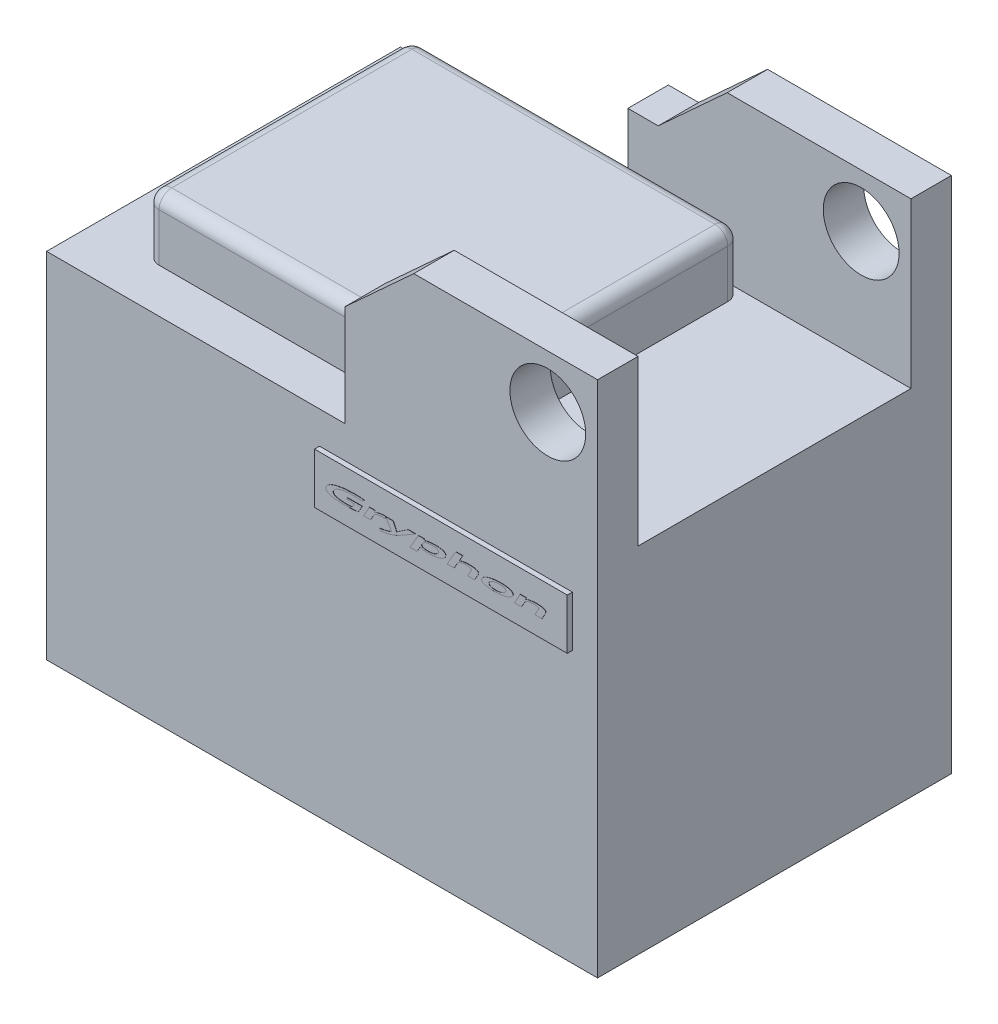
from build123d import *

# Parameters (mm, degrees)
SKETCH2_W           = 218
SKETCH2_H           = 140
BOSS_EXTRUDE1_DEPTH = 140
SKETCH3_W           = 130
SKETCH3_H           = 105
BOSS_EXTRUDE2_DEPTH = 24
FILLET1_R           = 5
FILLET2_R           = 5
BOSS_EXTRUDE3_DEPTH = 16
SKETCH5_R           = 15
CUT_EXTRUDE1_DEPTH  = 16
SKETCH6_W           = 12
SKETCH6_H           = 40
BOSS_EXTRUDE4_DEPTH = 16
SKETCH7_W           = 100
SKETCH7_H           = 20
BOSS_EXTRUDE5_DEPTH = 2
BOSS_EXTRUDE6_DEPTH = 0.1
SKETCH9_R           = 30
CUT_EXTRUDE2_DEPTH  = 1


with BuildPart() as part:
    # Sketch2 → Boss-Extrude1 (new body)
    with BuildSketch(Plane(origin=(0, 0, 0), x_dir=(1, 0, 0), z_dir=(0, 1, 0))):
        Rectangle(SKETCH2_W, SKETCH2_H)
    extrude(amount=BOSS_EXTRUDE1_DEPTH)

    # Sketch3 → Boss-Extrude2 (add)
    with BuildSketch(Plane(origin=(0, 140, 0), x_dir=(1, 0, 0), z_dir=(0, 1, 0))):
        with Locations((-22, 0)):
            Rectangle(SKETCH3_W, SKETCH3_H)
    extrude(amount=BOSS_EXTRUDE2_DEPTH)

    # Fillet1
    fillet1_edges = [part.edges().sort_by_distance(p)[0] for p in [
        (43, 164, 0),
        (-22, 164, -52.5),
        (-87, 164, 0),
        (-22, 164, 52.5),
    ]]
    fillet(fillet1_edges, radius=FILLET1_R)

    # Fillet2
    # the kernel refuses this fillet: 5 mm, written as the material it takes off along each edge
    with BuildSketch(Plane(origin=(38, 159, 47.5), x_dir=(1, 0, 0), z_dir=(0, 0, 1))) as fillet2_piece_1_section:
        Polygon((0, 0), (FILLET2_R, 0), (FILLET2_R, FILLET2_R), (0, FILLET2_R), align=None)
    fillet2_piece_1 = extrude(amount=FILLET2_R, mode=Mode.PRIVATE)
    fillet2_piece_1 = fillet2_piece_1 - Plane(origin=(38, 159, 47.5), x_dir=(-0.7071067811865475, -0.7071067811865475, 0), z_dir=(0, 0, 1)) * Sphere(FILLET2_R, mode=Mode.PRIVATE)
    add(fillet2_piece_1, mode=Mode.SUBTRACT)
    with BuildSketch(Plane(origin=(-82, 159, 47.5), x_dir=(-1, 0, 0), z_dir=(0, 0, 1))) as fillet2_piece_2_section:
        Polygon((0, 0), (FILLET2_R, 0), (FILLET2_R, -FILLET2_R), (0, -FILLET2_R), align=None)
    fillet2_piece_2 = extrude(amount=FILLET2_R, mode=Mode.PRIVATE)
    fillet2_piece_2 = fillet2_piece_2 - Plane(origin=(-82, 159, 47.5), x_dir=(0.7071067811865475, -0.7071067811865475, 0), z_dir=(0, 0, 1)) * Sphere(FILLET2_R, mode=Mode.PRIVATE)
    add(fillet2_piece_2, mode=Mode.SUBTRACT)
    with BuildSketch(Plane(origin=(38, 159, -47.5), x_dir=(0, 0, -1), z_dir=(1, 0, 0))) as fillet2_piece_3_section:
        Polygon((0, 0), (FILLET2_R, 0), (FILLET2_R, FILLET2_R), (0, FILLET2_R), align=None)
    fillet2_piece_3 = extrude(amount=FILLET2_R, mode=Mode.PRIVATE)
    fillet2_piece_3 = fillet2_piece_3 - Plane(origin=(38, 159, -47.5), x_dir=(0, -0.7071067811865475, 0.7071067811865475), z_dir=(1, 0, 0)) * Sphere(FILLET2_R, mode=Mode.PRIVATE)
    add(fillet2_piece_3, mode=Mode.SUBTRACT)
    with BuildSketch(Plane(origin=(-82, 159, -47.5), x_dir=(0, 0, -1), z_dir=(-1, 0, 0))) as fillet2_piece_4_section:
        Polygon((0, 0), (FILLET2_R, 0), (FILLET2_R, -FILLET2_R), (0, -FILLET2_R), align=None)
    fillet2_piece_4 = extrude(amount=FILLET2_R, mode=Mode.PRIVATE)
    fillet2_piece_4 = fillet2_piece_4 - Plane(origin=(-82, 159, -47.5), x_dir=(0, -0.7071067811865475, 0.7071067811865475), z_dir=(-1, 0, 0)) * Sphere(FILLET2_R, mode=Mode.PRIVATE)
    add(fillet2_piece_4, mode=Mode.SUBTRACT)
    with BuildSketch(Plane(origin=(-87, 140, -52.5), x_dir=(0, 0, 1), z_dir=(0, 1, 0)), Plane(origin=(-87, 140, 52.5), x_dir=(1, 0, 0), z_dir=(0, 1, 0))) as fillet2_piece_5:
        with BuildLine():
            CenterArc((FILLET2_R, FILLET2_R), FILLET2_R, 180, 90)
            Line((0, FILLET2_R), (0, 0))
            Line((0, 0), (FILLET2_R, 0))
        make_face()
    extrude(amount=19, mode=Mode.SUBTRACT)
    with BuildSketch(Plane(origin=(43, 140, -52.5), x_dir=(0, 0, 1), z_dir=(0, 1, 0)), Plane(origin=(43, 140, 52.5), x_dir=(-1, 0, 0), z_dir=(0, 1, 0))) as fillet2_piece_6:
        with BuildLine():
            CenterArc((FILLET2_R, -FILLET2_R), FILLET2_R, 90, 90)
            Line((0, -FILLET2_R), (0, 0))
            Line((0, 0), (FILLET2_R, 0))
        make_face()
    extrude(amount=19, mode=Mode.SUBTRACT)

    # Sketch4 → Boss-Extrude3 (add)
    with BuildSketch(Plane.XY.offset(70)):
        Polygon((109, 140), (109, 205), (36.276363394, 205), (9, 180), (9, 140), align=None)
    boss_extrude3 = extrude(amount=-BOSS_EXTRUDE3_DEPTH)

    # Sketch5 → Cut-Extrude1 (cut)
    with BuildSketch(Plane.XY.offset(70)):
        with Locations((89.3, 184)):
            Circle(SKETCH5_R)
    cut_extrude1 = extrude(amount=-CUT_EXTRUDE1_DEPTH, mode=Mode.SUBTRACT)

    # Mirror1: Boss-Extrude3, Cut-Extrude1 across plane
    add(boss_extrude3.mirror(Plane.XY))
    add(cut_extrude1.mirror(Plane.XY), mode=Mode.SUBTRACT)

    # Sketch6 → Boss-Extrude4 (add)
    with BuildSketch(Plane(origin=(0, 0, -70), x_dir=(-1, 0, 0), z_dir=(0, 0, -1))):
        with Locations((-3, 160)):
            Rectangle(SKETCH6_W, SKETCH6_H)
    extrude(amount=-BOSS_EXTRUDE4_DEPTH)

    # Sketch7 → Boss-Extrude5 (add)
    with BuildSketch(Plane.XY.offset(70)):
        with Locations((49, 117.237797082)):
            Rectangle(SKETCH7_W, SKETCH7_H)
    extrude(amount=BOSS_EXTRUDE5_DEPTH)

    # Sketch8 → Boss-Extrude6 (add)
    # profile 1 of 7: a face of its own
    with BuildSketch(Plane.XY.offset(72)):
        with BuildLine():
            Line((17.96418734, 117.160679351), (12.141424909, 117.160679351))
            Line((12.141424909, 117.160679351), (11.764252894, 116.507481764))
            Line((11.764252894, 116.507481764), (14.911006135, 116.507481764))
            Line((14.911006135, 116.507481764), (13.993461477, 114.918447558))
            add(Edge.make_bspline(
                [(13.993461477, 114.918447558), (13.963867753, 114.913749876), (13.901788444, 114.90389546), (13.803476553, 114.893148704), (13.696442108, 114.881185383), (13.579823698, 114.870688454), (13.454037911, 114.861613482), (13.318837078, 114.852066784), (13.174532896, 114.842381459), (13.02105319, 114.834005069), (12.85876924, 114.827083667), (12.688146369, 114.819002949), (12.509005078, 114.814200097), (12.321812502, 114.810219119), (12.126216566, 114.805748161), (11.922530752, 114.802301562), (11.710404062, 114.801912003), (11.566420365, 114.801136188), (11.493023831, 114.800740711)],
                knots=[0, 0, 0, 0, 0.57408566, 1.204270245, 1.894635667, 2.637907874, 3.447688264, 4.311161431, 5.235058642, 6.219005921, 7.256383574, 8.347542599, 9.492013257, 10.690125786, 11.935331768, 13.240966305, 14.593566391, 16, 16, 16, 16], degree=3))
            add(Edge.make_bspline(
                [(11.493023831, 114.800740711), (11.381341874, 114.800997446), (11.161464178, 114.8015029), (10.837329716, 114.809889757), (10.523626716, 114.819339559), (10.220954787, 114.836054151), (9.928954903, 114.853872535), (9.648110226, 114.879138813), (9.377820988, 114.90543574), (9.118301494, 114.938454561), (8.870042989, 114.97544854), (8.63200088, 115.014929711), (8.405129322, 115.06033697), (8.188945239, 115.109439006), (7.984061041, 115.163917326), (7.789164602, 115.219602357), (7.605623199, 115.282334188), (7.4331045, 115.348025603), (7.273658095, 115.418042822), (7.127908112, 115.491816259), (6.99753411, 115.570294951), (6.882044694, 115.653185078), (6.779479276, 115.73772556), (6.694107429, 115.829049614), (6.622283725, 115.923228455), (6.56579689, 116.022008545), (6.524379303, 116.124833635), (6.497606929, 116.231855596), (6.485809538, 116.342892836), (6.49106782, 116.45753431), (6.508789855, 116.576139764), (6.543707219, 116.697835018), (6.590779079, 116.824610486), (6.633176026, 116.907180828), (6.655147511, 116.949971481)],
                knots=[0, 0, 0, 0, 1.727237085, 3.400557444, 5.014613926, 6.580993404, 8.088679817, 9.538837814, 10.941847069, 12.288552396, 13.584395749, 14.823779686, 16.01999539, 17.162332673, 18.251837206, 19.298587379, 20.296512985, 21.250734898, 22.15296166, 22.988576607, 23.775688061, 24.503685507, 25.185911807, 25.827582618, 26.432647762, 27.014041907, 27.581882356, 28.141743999, 28.715167865, 29.302167277, 29.91208856, 30.565671226, 31.2566839, 32, 32, 32, 32], degree=3))
            add(Edge.make_bspline(
                [(6.655147511, 116.949971481), (6.684655585, 116.995068392), (6.744030174, 117.085810018), (6.846838111, 117.214257209), (6.957828629, 117.340316307), (7.082343454, 117.460002751), (7.21599827, 117.577555081), (7.361739032, 117.689874858), (7.517895289, 117.798438206), (7.684806298, 117.903024073), (7.862960005, 118.002711277), (8.051954066, 118.09886548), (8.252141716, 118.190123435), (8.463273682, 118.27775652), (8.685459183, 118.360749705), (8.9186607, 118.439291373), (9.162030764, 118.515950444), (9.505225075, 118.609573924), (9.952292679, 118.719157948), (10.509665455, 118.829688823), (11.091206278, 118.924549597), (11.696627935, 119.00227334), (12.326685091, 119.061881869), (12.980861572, 119.10448516), (13.659580997, 119.131732757), (14.120186117, 119.134611946), (14.354450678, 119.136076307)],
                knots=[0, 0, 0, 0, 0.469271586, 0.944243537, 1.431828891, 1.931625201, 2.447685653, 2.981954091, 3.533635011, 4.104102054, 4.697262929, 5.3116336, 5.950994489, 6.613508287, 7.302840866, 8.016880278, 8.757174479, 9.525441728, 11.115690773, 12.766372667, 14.474532637, 16.248290545, 18.08315634, 19.987281648, 21.959124501, 24, 24, 24, 24], degree=3))
            add(Edge.make_bspline(
                [(14.354450678, 119.136076307), (14.455591862, 119.135883232), (14.654016317, 119.135504447), (14.945154136, 119.132269895), (15.224006455, 119.127171572), (15.490189138, 119.119452801), (15.744128013, 119.111466664), (15.985751331, 119.100834286), (16.214755339, 119.08846957), (16.431752134, 119.073366425), (16.638249228, 119.057522245), (16.83598195, 119.040771545), (17.025970134, 119.02277738), (17.207922773, 119.004081581), (17.381663011, 118.983565642), (17.547281303, 118.964428243), (17.704435932, 118.941602696), (17.806569248, 118.926445942), (17.856432579, 118.919046141)],
                knots=[0, 0, 0, 0, 1.382312646, 2.711898585, 3.979238108, 5.194018751, 6.351375805, 7.451547184, 8.499458767, 9.485682463, 10.42438263, 11.32998213, 12.197766839, 13.032591748, 13.829770182, 14.588816052, 15.311034485, 16, 16, 16, 16], degree=3))
            Line((17.856432579, 118.919046141), (18.88391728, 119.622447592))
            add(Edge.make_bspline(
                [(18.88391728, 119.622447592), (18.82907582, 119.631239698), (18.714746639, 119.649568792), (18.536120008, 119.673186776), (18.34436921, 119.696423533), (18.139257235, 119.718487602), (17.92050383, 119.739766617), (17.687934747, 119.758235426), (17.44210672, 119.776205402), (17.183654582, 119.793159181), (16.913926029, 119.807811279), (16.634344306, 119.819993244), (16.346069481, 119.832365892), (16.048208939, 119.839923941), (15.741643863, 119.847759234), (15.425919182, 119.852849201), (15.101420828, 119.856124084), (14.881926133, 119.856506689), (14.770600754, 119.856700741)],
                knots=[0, 0, 0, 0, 0.646480929, 1.347732822, 2.097122365, 2.894782075, 3.748959429, 4.655347781, 5.610329598, 6.618045377, 7.67015949, 8.754528216, 9.875479017, 11.028693505, 12.222664842, 13.445078509, 14.704170934, 16, 16, 16, 16], degree=3))
            add(Edge.make_bspline(
                [(14.770600754, 119.856700741), (14.598515517, 119.855782061), (14.257123811, 119.853959534), (13.749649851, 119.842717363), (13.251251812, 119.827604556), (12.762067338, 119.804801653), (12.282187085, 119.778616354), (11.811742001, 119.742412352), (11.350380907, 119.704899163), (10.898150512, 119.657668441), (10.455254661, 119.606266982), (10.021279908, 119.55008729), (9.59732292, 119.48471575), (9.181438535, 119.417441864), (8.775630933, 119.340977057), (8.378588873, 119.260191357), (7.991269873, 119.172579567), (7.613952321, 119.080217035), (7.249195113, 118.983520628), (6.900959133, 118.878240321), (6.567919825, 118.771833105), (6.252424356, 118.657638634), (5.952407784, 118.540010744), (5.669299791, 118.416747891), (5.402126848, 118.289699693), (5.151942403, 118.15665608), (4.918194529, 118.019343833), (4.701193413, 117.876174476), (4.499661392, 117.729832134), (4.316173794, 117.576112981), (4.147613093, 117.419578265), (3.996749197, 117.256500839), (3.860712029, 117.089707851), (3.782628811, 116.972050253), (3.744204072, 116.914150968)],
                knots=[0, 0, 0, 0, 1.406086872, 2.789468771, 4.147410128, 5.480206865, 6.790810134, 8.074091919, 9.335395925, 10.572856075, 11.789057602, 12.978545271, 14.148113698, 15.293966537, 16.420685553, 17.521997493, 18.604487486, 19.665124284, 20.695970946, 21.687338376, 22.637427463, 23.552351842, 24.428362842, 25.27010105, 26.074832485, 26.845032507, 27.584693568, 28.289029961, 28.96856128, 29.618488189, 30.243756049, 30.846788552, 31.432504833, 32, 32, 32, 32], degree=3))
            add(Edge.make_bspline(
                [(3.744204072, 116.914150968), (3.719238936, 116.875069421), (3.669863861, 116.797775458), (3.61507779, 116.67165795), (3.576640721, 116.540410191), (3.556597187, 116.403180591), (3.555195325, 116.260949298), (3.569850703, 116.113467292), (3.604190358, 115.961065474), (3.64343369, 115.830603336), (3.688091303, 115.725069148), (3.734620857, 115.646226799), (3.791361265, 115.568535933), (3.859638986, 115.49255629), (3.937983451, 115.417322099), (4.027922565, 115.344042282), (4.128349435, 115.27096871), (4.24004191, 115.200131716), (4.361709703, 115.128965679), (4.494735883, 115.059652801), (4.638971446, 114.991468878), (4.794006695, 114.924242261), (4.959527133, 114.857366524), (5.136857387, 114.794089841), (5.324000422, 114.729271721), (5.523464589, 114.666793943), (5.736913477, 114.606481137), (5.967285044, 114.54934804), (6.215140066, 114.497363859), (6.480776251, 114.448869558), (6.763276094, 114.404147871), (7.06347213, 114.361445146), (7.381138779, 114.324366413), (7.716472142, 114.289106175), (8.069192458, 114.259278387), (8.439308133, 114.23140588), (8.826754147, 114.208909174), (9.23165021, 114.188422581), (9.654182227, 114.173226529), (10.094209983, 114.160223934), (10.55183384, 114.152106338), (10.862650661, 114.149083496), (11.021035897, 114.147543125)],
                knots=[0, 0, 0, 0, 0.621266322, 1.228716371, 1.836969588, 2.451213088, 3.082524631, 3.740632516, 4.434522164, 5.175010374, 5.565321413, 5.96849714, 6.40003937, 6.853839433, 7.336938835, 7.855656977, 8.408764672, 9.002020693, 9.628993758, 10.299048017, 11.013376269, 11.768641283, 12.565552984, 13.407514051, 14.293899999, 15.222110112, 16.21084147, 17.26882304, 18.405238495, 19.607330629, 20.890611674, 22.241670805, 23.674391156, 25.180455862, 26.764460969, 28.422466226, 30.15911932, 31.970262377, 33.860596466, 35.830503518, 37.875318711, 40, 40, 40, 40], degree=3))
            add(Edge.make_bspline(
                [(11.021035897, 114.147543125), (11.292158928, 114.149189648), (11.824980058, 114.152425458), (12.609928217, 114.171052646), (13.366115067, 114.197822408), (13.976373838, 114.229204442), (14.444433587, 114.257263297), (14.773754485, 114.28004684), (15.085341732, 114.300530321), (15.378613796, 114.322380222), (15.654164386, 114.346412483), (15.911731351, 114.367567397), (16.151188035, 114.391061345), (16.304571409, 114.407324838), (16.378309653, 114.415143426)],
                knots=[0, 0, 0, 0, 1.818900664, 3.574571683, 5.267282731, 6.895007302, 7.673911258, 8.412994653, 9.109607772, 9.76878893, 10.385883484, 10.965218059, 11.502534069, 12, 12, 12, 12], degree=3))
            Line((16.378309653, 114.415143426), (17.96418734, 117.160679351))
        make_face()
    # profile 2 of 7: a face of its own
    with BuildSketch(Plane.XY.offset(72)):
        with BuildLine():
            add(Edge.make_bspline(
                [(27.491893726, 118.313258057), (27.433896933, 118.311980744), (27.320776615, 118.309489398), (27.151423376, 118.309582928), (26.978662823, 118.312937684), (26.861009024, 118.312456085), (26.799550377, 118.312204512)],
                knots=[0, 0, 0, 0, 1.005383454, 1.96095836, 2.934868736, 4, 4, 4, 4], degree=3))
            add(Edge.make_bspline(
                [(26.799550377, 118.312204512), (26.617566055, 118.309134304), (26.255250109, 118.30302177), (25.715402859, 118.261101579), (25.182197914, 118.192052111), (24.744298082, 118.114555374), (24.402576573, 118.040249516), (24.157471181, 117.979501817), (23.924105013, 117.911708592), (23.70137733, 117.840606378), (23.490231322, 117.763421739), (23.289590012, 117.681535403), (23.100166708, 117.593421838), (22.97948502, 117.529238587), (22.920399547, 117.497814618)],
                knots=[0, 0, 0, 0, 1.637789355, 3.260705074, 4.869975785, 6.475116374, 7.261198031, 8.017024643, 8.74725353, 9.44791687, 10.120828127, 10.769975949, 11.397783091, 12, 12, 12, 12], degree=3))
            Line((22.920399547, 117.497814618), (22.825409753, 117.497945282))
            Line((22.825409753, 117.497945282), (23.162218874, 118.245831209))
            Line((23.162218874, 118.245831209), (20.762169409, 118.245831209))
            add(Edge.make_bspline(
                [(20.762169409, 118.245831209), (20.723568027, 118.151673513), (20.64306938, 117.955318705), (20.499301233, 117.65690486), (20.333753687, 117.339783415), (20.21042803, 117.125473461), (20.146416893, 117.014237695)],
                knots=[0, 0, 0, 0, 0.8858633, 1.847363787, 2.882692406, 4, 4, 4, 4], degree=3))
            Line((20.146416893, 117.014237695), (18.526394692, 114.208647676))
            Line((18.526394692, 114.208647676), (21.282474293, 114.208647676))
            Line((21.282474293, 114.208647676), (22.517860156, 116.348130073))
            add(Edge.make_bspline(
                [(22.517860156, 116.348130073), (22.546566471, 116.391955573), (22.605557802, 116.48201675), (22.719418005, 116.603449406), (22.852571251, 116.718917634), (23.005805599, 116.828593122), (23.180410698, 116.930272136), (23.375400848, 117.025031342), (23.590644763, 117.112942134), (23.825089025, 117.194852149), (24.076513342, 117.268064002), (24.342949878, 117.33067293), (24.622259038, 117.385610574), (24.915345884, 117.430908708), (25.222241307, 117.465271956), (25.542384331, 117.489842806), (25.875746476, 117.507752412), (26.102430496, 117.510241673), (26.217993816, 117.511510696)],
                knots=[0, 0, 0, 0, 0.625962778, 1.286350288, 1.983352948, 2.733271445, 3.537654452, 4.398485167, 5.325657178, 6.318518059, 7.369174495, 8.457841149, 9.592775774, 10.774999121, 12.005801768, 13.287375244, 14.617106219, 16, 16, 16, 16], degree=3))
            add(Edge.make_bspline(
                [(26.217993816, 117.511510696), (26.29209651, 117.511437435), (26.435398615, 117.51129576), (26.642597552, 117.506581354), (26.834763535, 117.50103783), (26.957594432, 117.493878078), (27.016580543, 117.490439806)],
                knots=[0, 0, 0, 0, 1.112907013, 2.152174352, 3.112633302, 4, 4, 4, 4], degree=3))
            Line((27.016580543, 117.490439806), (27.491893726, 118.313258057))
        make_face()
    # profile 3 of 7: a face of its own
    with BuildSketch(Plane.XY.offset(72)):
        with BuildLine():
            Line((36.170676799, 118.245831209), (32.744792911, 115.988344628))
            add(Edge.make_bspline(
                [(32.744792911, 115.988344628), (32.644622311, 115.919301242), (32.443796919, 115.780880738), (32.19225233, 115.610285692), (31.996649232, 115.471998789), (31.854368057, 115.374544562), (31.720673674, 115.278574594), (31.633169453, 115.216500902), (31.590649321, 115.186337996)],
                knots=[0, 0, 0, 0, 1.55811736, 3.123766129, 3.892371864, 4.625979904, 5.332334883, 6, 6, 6, 6], degree=3))
            Line((31.590649321, 115.186337996), (31.51915645, 115.187301002))
            add(Edge.make_bspline(
                [(31.51915645, 115.187301002), (31.503228451, 115.249564489), (31.469916814, 115.379781644), (31.412878336, 115.579400268), (31.346538913, 115.78499973), (31.2928783, 115.920574791), (31.266157617, 115.988085357)],
                knots=[0, 0, 0, 0, 0.917495057, 1.918838817, 2.963670987, 4, 4, 4, 4], degree=3))
            Line((31.266157617, 115.988085357), (30.185146888, 118.245831209))
            Line((30.185146888, 118.245831209), (27.156611833, 118.245831209))
            Line((27.156611833, 118.245831209), (29.527545814, 114.546466101))
            add(Edge.make_bspline(
                [(29.527545814, 114.546466101), (29.540604462, 114.528749209), (29.563864002, 114.497192591), (29.586387559, 114.44949018), (29.590053969, 114.404132969), (29.575805691, 114.381747916), (29.568897436, 114.370894557)],
                knots=[0, 0, 0, 0, 1.350795105, 2.405982161, 3.227142866, 4, 4, 4, 4], degree=3))
            add(Edge.make_bspline(
                [(29.568897436, 114.370894557), (29.565976553, 114.365445129), (29.558805163, 114.352065618), (29.538720218, 114.334448029), (29.512245756, 114.312622623), (29.476207123, 114.290508617), (29.432707119, 114.264516529), (29.379727072, 114.237898271), (29.31896669, 114.207002187), (29.24878228, 114.174578521), (29.170786858, 114.138726007), (29.083555492, 114.102257846), (28.988770319, 114.06165214), (28.884653469, 114.01988492), (28.771703552, 113.975847051), (28.650781795, 113.928179159), (28.521137616, 113.878798301), (28.383250966, 113.827181144), (28.237059771, 113.773733146), (28.080791952, 113.723620094), (27.9154681, 113.674590932), (27.74195634, 113.624516881), (27.559120904, 113.577422217), (27.367660519, 113.531268109), (27.167610149, 113.485621015), (26.958363686, 113.443026217), (26.740402541, 113.399528859), (26.513253972, 113.357219012), (26.276988964, 113.318003958), (26.032463693, 113.277066614), (25.778735168, 113.239812907), (25.516073811, 113.202736703), (25.244589592, 113.166985131), (25.060447207, 113.144426045), (24.967015083, 113.132979776)],
                knots=[0, 0, 0, 0, 0.1227252, 0.301316599, 0.52592964, 0.810045162, 1.143347849, 1.538726561, 1.993668565, 2.505240093, 3.082963426, 3.708466264, 4.393857033, 5.14296516, 5.949408303, 6.815787384, 7.739575849, 8.720825834, 9.757185161, 10.848757423, 11.998524505, 13.202167461, 14.45627752, 15.769925468, 17.136625498, 18.555209431, 20.035678654, 21.576842086, 23.170819032, 24.820157964, 26.529709358, 28.293799972, 30.119508779, 32, 32, 32, 32], degree=3))
            Line((24.967015083, 113.132979776), (25.271174613, 112.420059386))
            add(Edge.make_bspline(
                [(25.271174613, 112.420059386), (25.315890986, 112.422588203), (25.409847145, 112.427901647), (25.556391249, 112.439738256), (25.71512871, 112.454573019), (25.885054058, 112.472651518), (26.06659363, 112.492853793), (26.259904052, 112.514392884), (26.464472669, 112.541452777), (26.757052072, 112.579296491), (27.139851989, 112.635473807), (27.615582292, 112.720988771), (28.112429868, 112.820392803), (28.449507053, 112.897577444), (28.621760935, 112.9370205)],
                knots=[0, 0, 0, 0, 0.475047191, 0.998149148, 1.559321855, 2.166079221, 2.810669925, 3.496811616, 4.229124421, 4.999336376, 6.626083314, 8.332266493, 10.125707211, 12, 12, 12, 12], degree=3))
            add(Edge.make_bspline(
                [(28.621760935, 112.9370205), (28.733963619, 112.965875606), (28.959187284, 113.02379626), (29.294280853, 113.122487627), (29.629148743, 113.227827129), (29.962627229, 113.341326778), (30.295151496, 113.463951534), (30.626539429, 113.594756412), (30.957978077, 113.732232515), (31.289235468, 113.881326438), (31.626451413, 114.039661523), (31.973725011, 114.20769231), (32.332490046, 114.38889873), (32.703781303, 114.579834914), (33.086883992, 114.78367046), (33.481117373, 114.999884284), (33.888501472, 115.225866659), (34.162209508, 115.383332158), (34.301419306, 115.463420198)],
                knots=[0, 0, 0, 0, 0.891541351, 1.789584743, 2.687949359, 3.593053526, 4.500285741, 5.415214587, 6.334746377, 7.261447158, 8.210561812, 9.201745757, 10.230327648, 11.303709871, 12.414826369, 13.569882142, 14.764025269, 16, 16, 16, 16], degree=3))
            Line((34.301419306, 115.463420198), (39.07997819, 118.245831209))
            Line((39.07997819, 118.245831209), (36.170676799, 118.245831209))
        make_face()
    # profile 4 of 7: a face of its own
    with BuildSketch(Plane.XY.offset(72)):
        with BuildLine():
            Line((42.311969148, 117.631749548), (42.523998064, 118.245831209))
            Line((42.523998064, 118.245831209), (40.100189319, 118.245831209))
            add(Edge.make_bspline(
                [(40.100189319, 118.245831209), (40.079838381, 118.199745047), (40.038224055, 118.105506413), (39.970627806, 117.961816682), (39.901391068, 117.810183859), (39.823315343, 117.6526886), (39.740218854, 117.487034635), (39.649719293, 117.312189623), (39.547965613, 117.129750891), (39.477464147, 117.004725752), (39.441241478, 116.94048958)],
                knots=[0, 0, 0, 0, 0.826438279, 1.689930601, 2.604930101, 3.560821106, 4.573365849, 5.645317194, 6.790196837, 8, 8, 8, 8], degree=3))
            Line((39.441241478, 116.94048958), (36.930002943, 112.590404361))
            Line((36.930002943, 112.590404361), (39.686082543, 112.590404361))
            Line((39.686082543, 112.590404361), (40.896787275, 114.687141042))
            Line((40.896787275, 114.687141042), (40.944392259, 114.687141042))
            add(Edge.make_bspline(
                [(40.944392259, 114.687141042), (40.975791651, 114.666924564), (41.041805576, 114.624421545), (41.152069876, 114.567604908), (41.278087577, 114.515882414), (41.417915619, 114.465352387), (41.572608343, 114.417886979), (41.741816997, 114.374245517), (41.925898713, 114.332948427), (42.124188058, 114.295767752), (42.335494135, 114.260514861), (42.558728238, 114.231717671), (42.793006778, 114.206297288), (43.038559987, 114.185489682), (43.295643601, 114.168344015), (43.564389858, 114.157314556), (43.84431288, 114.149709043), (44.034690278, 114.148273855), (44.131621568, 114.147543125)],
                knots=[0, 0, 0, 0, 0.548571698, 1.15331436, 1.819437073, 2.549134295, 3.337564836, 4.196234211, 5.11646505, 6.109362326, 7.160538303, 8.264095413, 9.416433316, 10.623284445, 11.885185345, 13.202372804, 14.575578744, 16, 16, 16, 16], degree=3))
            add(Edge.make_bspline(
                [(44.131621568, 114.147543125), (44.310049011, 114.148421182), (44.665304291, 114.150169425), (45.194760773, 114.174580898), (45.718023988, 114.212681318), (46.234337481, 114.269504433), (46.74484976, 114.33886691), (47.248192387, 114.428022852), (47.745334778, 114.532522864), (48.153713354, 114.631949055), (48.473073862, 114.71940759), (48.702188368, 114.791762835), (48.92196325, 114.867074018), (49.132317575, 114.94702245), (49.332646223, 115.032828439), (49.524117402, 115.121779991), (49.706061882, 115.21560091), (49.877684508, 115.314846268), (50.040549236, 115.417872714), (50.193239786, 115.526562303), (50.336768819, 115.639325215), (50.47121046, 115.756312604), (50.595407585, 115.87871336), (50.710527385, 116.004948441), (50.815733613, 116.136263439), (50.878715865, 116.227896157), (50.910126847, 116.273595915)],
                knots=[0, 0, 0, 0, 1.749518162, 3.483351857, 5.196169527, 6.893421242, 8.576062741, 10.247371881, 11.904793908, 13.556876784, 14.368142493, 15.151255288, 15.91249845, 16.646069769, 17.35734874, 18.049085477, 18.715998254, 19.363971019, 19.992574743, 20.605068277, 21.200986425, 21.781838558, 22.351663133, 22.909934554, 23.456354373, 24, 24, 24, 24], degree=3))
            add(Edge.make_bspline(
                [(50.910126847, 116.273595915), (50.929897442, 116.312217398), (50.968170488, 116.386983072), (51.010718319, 116.501807289), (51.043762306, 116.612405949), (51.061119539, 116.72075068), (51.0685578, 116.825654854), (51.060906186, 116.927721629), (51.040416157, 117.026244983), (51.00937438, 117.122103758), (50.962517377, 117.21344168), (50.904854888, 117.302261751), (50.832763501, 117.386820298), (50.749792492, 117.469301388), (50.652528505, 117.546984221), (50.544300766, 117.623141327), (50.422316278, 117.694455404), (50.288704606, 117.762361832), (50.144648613, 117.82760739), (49.990869591, 117.88836557), (49.828469364, 117.94520063), (49.657342466, 117.997983242), (49.477337347, 118.046114725), (49.288344817, 118.090570715), (49.090347993, 118.129906189), (48.88368402, 118.167539916), (48.667817924, 118.198528926), (48.443298306, 118.225662306), (48.210131134, 118.250109556), (47.968142512, 118.270334748), (47.716914914, 118.284334989), (47.45704581, 118.29625612), (47.188346228, 118.303655135), (47.006397688, 118.30513301), (46.914032579, 118.305883245)],
                knots=[0, 0, 0, 0, 0.783967079, 1.517648262, 2.211197479, 2.867944143, 3.497855484, 4.10917858, 4.712030277, 5.314547334, 5.925210254, 6.562886, 7.225624333, 7.930709463, 8.675630023, 9.473772472, 10.322278705, 11.228372126, 12.183424488, 13.181172037, 14.21762592, 15.294392814, 16.419037524, 17.586757103, 18.804908257, 20.069412796, 21.385253279, 22.748075891, 24.159246931, 25.624972791, 27.139144497, 28.709417954, 30.329555338, 32, 32, 32, 32], degree=3))
            add(Edge.make_bspline(
                [(46.914032579, 118.305883245), (46.800244478, 118.305214842), (46.575095988, 118.303892296), (46.24072667, 118.29520773), (45.913725037, 118.28169973), (45.593743848, 118.262740184), (45.280803652, 118.238406349), (44.974745088, 118.209612996), (44.676014233, 118.172917009), (44.384691801, 118.133578584), (44.101203796, 118.088279441), (43.826590523, 118.037627005), (43.5602351, 117.982918977), (43.302630779, 117.923240267), (43.054029184, 117.85774686), (42.814030206, 117.788068458), (42.582521031, 117.714124458), (42.432419434, 117.658838676), (42.358506184, 117.631614769)],
                knots=[0, 0, 0, 0, 1.180034786, 2.334893086, 3.468521341, 4.573970542, 5.658861281, 6.723556569, 7.761633418, 8.779895503, 9.77201138, 10.738495252, 11.675596289, 12.591698284, 13.480358216, 14.341309962, 15.183225398, 16, 16, 16, 16], degree=3))
            Line((42.358506184, 117.631614769), (42.311969148, 117.631749548))
        make_face()
        with BuildLine():
            add(Edge.make_bspline(
                [(41.991473505, 116.582956292), (42.018977491, 116.620877028), (42.076724062, 116.700494302), (42.18962106, 116.806328041), (42.323334611, 116.909562157), (42.481558762, 117.005198458), (42.661424915, 117.098491498), (42.865303251, 117.185137573), (43.092452478, 117.266760648), (43.339549445, 117.343797777), (43.602244983, 117.413482441), (43.87452659, 117.475611394), (44.15425737, 117.528406017), (44.44077114, 117.571050419), (44.734420212, 117.606299016), (45.035235283, 117.631199798), (45.343386967, 117.647162506), (45.551078758, 117.650830763), (45.656100452, 117.652685659)],
                knots=[0, 0, 0, 0, 0.572488742, 1.201980716, 1.885767534, 2.638794848, 3.461967024, 4.365399234, 5.348906231, 6.416579018, 7.533722509, 8.676008067, 9.835669222, 11.018538531, 12.222388818, 13.45657037, 14.713886143, 16, 16, 16, 16], degree=3))
            add(Edge.make_bspline(
                [(45.656100452, 117.652685659), (45.72072261, 117.651868114), (45.847535914, 117.65026378), (46.033698673, 117.643903381), (46.212476907, 117.634382295), (46.383231721, 117.622153201), (46.546457426, 117.605673789), (46.701950066, 117.588866925), (46.849314069, 117.566054454), (46.989230818, 117.542078465), (47.121107522, 117.515133415), (47.245463294, 117.48429784), (47.361691525, 117.450644034), (47.471123849, 117.415365189), (47.571708177, 117.375063555), (47.665163685, 117.333086559), (47.750736912, 117.28777394), (47.851855895, 117.22512842), (47.960213219, 117.140897673), (48.067342581, 117.032322323), (48.144722175, 116.915594704), (48.191481675, 116.791287872), (48.208497131, 116.660846359), (48.195763259, 116.524877613), (48.153392341, 116.38338308), (48.105532414, 116.292862127), (48.080306335, 116.245150214)],
                knots=[0, 0, 0, 0, 1.371643797, 2.691687925, 3.953130468, 5.171354425, 6.324640231, 7.435025804, 8.490203245, 9.488901565, 10.447840699, 11.346300418, 12.207343918, 13.015809935, 13.785373337, 14.505870407, 15.189410198, 15.83885748, 17.028634333, 18.093481564, 19.063079426, 19.978203666, 20.887939314, 21.830664426, 22.85658351, 24, 24, 24, 24], degree=3))
            add(Edge.make_bspline(
                [(48.080306335, 116.245150214), (48.046784259, 116.192273972), (47.978404883, 116.084415363), (47.849542968, 115.936070571), (47.700625139, 115.79419323), (47.528184687, 115.662026619), (47.336156005, 115.535011026), (47.121313398, 115.417270803), (46.884167906, 115.308361797), (46.626987564, 115.205430126), (46.350448274, 115.111736513), (46.055942193, 115.030907292), (45.744255693, 114.962767511), (45.415870281, 114.906306566), (45.070374237, 114.861107976), (44.707723115, 114.827582194), (44.327829302, 114.806278975), (44.068788032, 114.802610886), (43.936715837, 114.800740711)],
                knots=[0, 0, 0, 0, 0.659114604, 1.344482561, 2.064520538, 2.824218982, 3.631181845, 4.489401407, 5.403585147, 6.380354747, 7.408125081, 8.4794996, 9.597684162, 10.769774013, 11.990638864, 13.269509042, 14.607859144, 16, 16, 16, 16], degree=3))
            add(Edge.make_bspline(
                [(43.936715837, 114.800740711), (43.848560894, 114.801284884), (43.674994591, 114.802356292), (43.419500905, 114.812659065), (43.173581935, 114.831902939), (42.936964943, 114.85770455), (42.709672084, 114.892775942), (42.491498848, 114.934132465), (42.283251126, 114.985361885), (42.116967109, 115.033207333), (41.991225072, 115.075121459), (41.906160242, 115.109813679), (41.828802528, 115.146824541), (41.759150541, 115.185410795), (41.697768907, 115.226553289), (41.644158518, 115.269648979), (41.599896549, 115.316572746), (41.562340677, 115.364848836), (41.533781155, 115.416181769), (41.512173296, 115.469101545), (41.499367762, 115.524594055), (41.495571791, 115.582441604), (41.498556504, 115.642663244), (41.51057136, 115.705264509), (41.530867898, 115.769739455), (41.54933448, 115.812300298), (41.558865912, 115.834267861)],
                knots=[0, 0, 0, 0, 2.122722861, 4.179381721, 6.155607564, 8.061615428, 9.909404976, 11.692274473, 13.406934966, 15.071504702, 15.85772805, 16.597366151, 17.281973846, 17.921821088, 18.512866488, 19.059666658, 19.574052989, 20.062848035, 20.5285679, 20.983962164, 21.435255115, 21.893155006, 22.375840333, 22.883368806, 23.423656477, 24, 24, 24, 24], degree=3))
            Line((41.558865912, 115.834267861), (41.991473505, 116.582956292))
        make_face(mode=Mode.SUBTRACT)
    # profile 5 of 7: a face of its own
    with BuildSketch(Plane.XY.offset(72)):
        with BuildLine():
            add(Edge.make_bspline(
                [(63.842230575, 116.660710757), (63.859983193, 116.698562892), (63.894203065, 116.771526509), (63.933564473, 116.881671095), (63.960201914, 116.987574816), (63.975283449, 117.089224082), (63.979101071, 117.1865199), (63.96954548, 117.279805068), (63.947386185, 117.36844609), (63.913123766, 117.452721689), (63.867388859, 117.532699367), (63.80860845, 117.607933039), (63.737671793, 117.678470037), (63.654409222, 117.744195094), (63.559164145, 117.804924035), (63.452100055, 117.862003983), (63.332895123, 117.91431514), (63.156324689, 117.978871013), (62.920433474, 118.050077517), (62.623567219, 118.123759118), (62.311765, 118.185886713), (61.984716708, 118.234848004), (61.643103672, 118.27259299), (61.286440925, 118.298927992), (60.914626865, 118.312561472), (60.661674425, 118.312325005), (60.532780844, 118.312204512)],
                knots=[0, 0, 0, 0, 0.680283627, 1.311311894, 1.900563149, 2.455159498, 2.98136411, 3.48136038, 3.976331434, 4.463583688, 4.957794899, 5.471205883, 6.012864739, 6.582460739, 7.194535027, 7.849251557, 8.555636355, 9.311695519, 10.908381589, 12.563831578, 14.289224788, 16.081615506, 17.94518449, 19.882665556, 21.90198514, 24, 24, 24, 24], degree=3))
            add(Edge.make_bspline(
                [(60.532780844, 118.312204512), (60.349781969, 118.310343187), (59.983565981, 118.306618316), (59.434617084, 118.277603658), (58.885892503, 118.228472544), (58.43056536, 118.173807537), (58.070479151, 118.120895191), (57.808511571, 118.075437972), (57.554534898, 118.025993671), (57.308494666, 117.972497579), (57.070758869, 117.913416126), (56.840992839, 117.85026451), (56.619220839, 117.783061047), (56.47509651, 117.733865639), (56.40393997, 117.709577061)],
                knots=[0, 0, 0, 0, 1.571991976, 3.14585865, 4.720725407, 6.303932277, 7.084697363, 7.847001477, 8.587749421, 9.307307378, 10.009725209, 10.691844333, 11.354142131, 12, 12, 12, 12], degree=3))
            Line((56.40393997, 117.709577061), (56.356782536, 117.709839419))
            Line((56.356782536, 117.709839419), (57.71748978, 120.066355067))
            Line((57.71748978, 120.066355067), (54.96141018, 120.066355067))
            Line((54.96141018, 120.066355067), (51.579035416, 114.208647676))
            Line((51.579035416, 114.208647676), (54.335115017, 114.208647676))
            Line((54.335115017, 114.208647676), (55.767999318, 116.690164733))
            add(Edge.make_bspline(
                [(55.767999318, 116.690164733), (55.796715121, 116.728120073), (55.85620008, 116.806744791), (55.968798927, 116.911650103), (56.102111305, 117.009486943), (56.254952278, 117.102629189), (56.430812142, 117.186013112), (56.626270685, 117.264917221), (56.843603326, 117.33623366), (57.078755108, 117.40009269), (57.326046028, 117.456918458), (57.578211402, 117.50769638), (57.83336954, 117.549819577), (58.090573591, 117.584376449), (58.350546256, 117.611854403), (58.612609844, 117.632042487), (58.877205167, 117.64365921), (59.054295873, 117.645460532), (59.143155656, 117.646364392)],
                knots=[0, 0, 0, 0, 0.632921781, 1.311101336, 2.039798979, 2.833101937, 3.690747485, 4.628748099, 5.638925992, 6.73500524, 7.872935208, 9.017669261, 10.160270621, 11.316508108, 12.473483215, 13.641466717, 14.81654572, 16, 16, 16, 16], degree=3))
            add(Edge.make_bspline(
                [(59.143155656, 117.646364392), (59.199349926, 117.645926104), (59.308953456, 117.645071251), (59.469450906, 117.639403116), (59.622235845, 117.632169104), (59.767313415, 117.622843622), (59.904973908, 117.611025237), (60.035092336, 117.59812723), (60.157470239, 117.580359338), (60.272294782, 117.563544516), (60.379282469, 117.541793612), (60.478882863, 117.519234512), (60.570876759, 117.493634033), (60.655408116, 117.467156143), (60.731367347, 117.435483484), (60.801286917, 117.405141448), (60.8626164, 117.369873962), (60.932436618, 117.322199996), (61.005412324, 117.257771304), (61.07539928, 117.174876546), (61.123420133, 117.085910892), (61.151095906, 116.992239502), (61.154611844, 116.893011238), (61.136322493, 116.790421881), (61.099166203, 116.683133263), (61.059429651, 116.615026732), (61.038482202, 116.579123818)],
                knots=[0, 0, 0, 0, 1.510161595, 2.945478964, 4.315549732, 5.620729203, 6.852024011, 8.028721633, 9.13386829, 10.175021882, 11.146745882, 12.067061805, 12.918817521, 13.712713175, 14.445281334, 15.12950358, 15.759293724, 16.343064023, 17.399588847, 18.365105742, 19.243376571, 20.097690509, 20.966785884, 21.885309563, 22.885223651, 24, 24, 24, 24], degree=3))
            Line((61.038482202, 116.579123818), (59.670273598, 114.208647676))
            Line((59.670273598, 114.208647676), (62.426353198, 114.208647676))
            Line((62.426353198, 114.208647676), (63.842230575, 116.660710757))
        make_face()
    # profile 6 of 7: a face of its own
    with BuildSketch(Plane.XY.offset(72)):
        with BuildLine():
            add(Edge.make_bspline(
                [(72.764651985, 118.306935761), (72.544924065, 118.304205835), (72.111841405, 118.298825164), (71.472540466, 118.271376007), (70.853233031, 118.226789711), (70.253189042, 118.168187766), (69.672955721, 118.088281047), (69.111936878, 117.994319149), (68.571117155, 117.882497818), (68.134693324, 117.7757129), (67.799251778, 117.680730289), (67.559706677, 117.607551064), (67.331793051, 117.529019127), (67.113782878, 117.450150117), (66.908730938, 117.363697087), (66.71312057, 117.276889723), (66.528667245, 117.185604502), (66.356160293, 117.089009184), (66.192605541, 116.991739361), (66.041826796, 116.888248282), (65.900546225, 116.782895737), (65.771099717, 116.67345554), (65.652337571, 116.560337963), (65.544944237, 116.443546687), (65.448229139, 116.323284855), (65.391786685, 116.239242298), (65.363914479, 116.197740711)],
                knots=[0, 0, 0, 0, 1.995102874, 3.932338038, 5.808812037, 7.632187601, 9.405289174, 11.125709712, 12.795998723, 14.418475214, 15.203782554, 15.961220033, 16.692264759, 17.392385892, 18.065664583, 18.71219726, 19.335348101, 19.933380913, 20.507012977, 21.062409814, 21.592987827, 22.106584795, 22.600483504, 23.081154104, 23.546258892, 24, 24, 24, 24], degree=3))
            add(Edge.make_bspline(
                [(65.363914479, 116.197740711), (65.344332713, 116.158827593), (65.306358956, 116.083365696), (65.267063416, 115.966827992), (65.239997169, 115.854403017), (65.226239131, 115.74507194), (65.23001573, 115.638691593), (65.246585416, 115.535422007), (65.27838137, 115.435542233), (65.326163749, 115.339868369), (65.386094342, 115.246574731), (65.462132426, 115.157618182), (65.552689217, 115.072634704), (65.656007153, 114.988473344), (65.775895448, 114.910555617), (65.908599238, 114.834382871), (66.056504136, 114.762935571), (66.21748813, 114.693980108), (66.390991003, 114.629156728), (66.574948389, 114.568247794), (66.768277211, 114.510008242), (66.971943115, 114.457740189), (67.185314061, 114.409538547), (67.407832154, 114.363846614), (67.640970986, 114.324442241), (67.88316967, 114.287069733), (68.135914997, 114.256184954), (68.397864742, 114.227513339), (68.669693905, 114.203030333), (68.951134835, 114.184876299), (69.242247001, 114.168601736), (69.54360916, 114.157293391), (69.854786443, 114.149749251), (70.065527995, 114.148284952), (70.172291553, 114.147543125)],
                knots=[0, 0, 0, 0, 0.692774146, 1.343455735, 1.952369371, 2.532144884, 3.091503576, 3.641165908, 4.19284348, 4.752956119, 5.339166035, 5.954107654, 6.610576595, 7.314363478, 8.072649652, 8.884029524, 9.749201546, 10.68596885, 11.671473514, 12.696943704, 13.770676925, 14.885377307, 16.043687567, 17.253130806, 18.501380563, 19.807658771, 21.15441084, 22.554748247, 24.002965283, 25.499169864, 27.044582888, 28.644811628, 30.300231502, 32, 32, 32, 32], degree=3))
            add(Edge.make_bspline(
                [(70.172291553, 114.147543125), (70.364765621, 114.14839148), (70.747751716, 114.150079543), (71.31963849, 114.174946359), (71.886066663, 114.211765748), (72.447532962, 114.266730534), (73.003165191, 114.338894166), (73.553965554, 114.42447356), (74.098647526, 114.528668062), (74.547772794, 114.626129823), (74.898471367, 114.714882786), (75.151049451, 114.783163621), (75.391286283, 114.86050941), (75.621834786, 114.938003871), (75.840924651, 115.022973219), (76.048635, 115.112532229), (76.246840418, 115.204294919), (76.431756433, 115.30435464), (76.607587105, 115.405987296), (76.771761308, 115.513358427), (76.924885013, 115.625417527), (77.067811545, 115.740890242), (77.198382071, 115.862657327), (77.319188973, 115.987836131), (77.428138997, 116.118671714), (77.492900146, 116.210299332), (77.524978582, 116.255685659)],
                knots=[0, 0, 0, 0, 1.758116323, 3.498310766, 5.228100881, 6.942916452, 8.650756017, 10.345893576, 12.033989053, 13.716038104, 14.543123953, 15.3385455, 16.105584625, 16.848204704, 17.560138691, 18.251389548, 18.914401039, 19.554501317, 20.171289967, 20.769227651, 21.345436509, 21.904088592, 22.446628422, 22.975295071, 23.492428221, 24, 24, 24, 24], degree=3))
            add(Edge.make_bspline(
                [(77.524978582, 116.255685659), (77.543875295, 116.293316865), (77.580485484, 116.366222963), (77.623294076, 116.477025444), (77.651118886, 116.585612882), (77.665151188, 116.691399175), (77.665398684, 116.794516923), (77.651525148, 116.894862548), (77.623874821, 116.992336831), (77.582494802, 117.087262282), (77.525580035, 117.177756277), (77.456445571, 117.26645714), (77.372305948, 117.350967943), (77.276584968, 117.435261098), (77.164742387, 117.513072635), (77.041282807, 117.590957046), (76.902596033, 117.663767745), (76.751447503, 117.735596775), (76.587272318, 117.802326357), (76.411445229, 117.865609123), (76.224682758, 117.925663702), (76.025936328, 117.980153662), (75.816480403, 118.030505435), (75.595522042, 118.077019285), (75.363234075, 118.118758497), (75.119451312, 118.156722435), (74.864409881, 118.190295317), (74.597797291, 118.219697458), (74.319950343, 118.244847535), (74.03052963, 118.265814389), (73.729900172, 118.282968091), (73.417957277, 118.293673834), (73.094871708, 118.302776934), (72.875693313, 118.304834707), (72.76401101, 118.305883245)],
                knots=[0, 0, 0, 0, 0.674494665, 1.306755167, 1.899066769, 2.466506162, 3.01232949, 3.54630608, 4.084270381, 4.631050049, 5.199492972, 5.792712658, 6.429389818, 7.107489554, 7.833574576, 8.609576469, 9.445358358, 10.341455276, 11.290275787, 12.283508938, 13.335224501, 14.432830004, 15.584726034, 16.786557911, 18.050340021, 19.365877587, 20.739475946, 22.171810284, 23.663476027, 25.209388128, 26.82123932, 28.487994253, 30.210458255, 32, 32, 32, 32], degree=3))
            Line((72.76401101, 118.305883245), (72.764651985, 118.306935761))
        make_face()
        with BuildLine():
            add(Edge.make_bspline(
                [(74.689454113, 116.234381219), (74.656356855, 116.184068562), (74.588487638, 116.08089746), (74.461175039, 115.938987016), (74.31215781, 115.803859209), (74.141607818, 115.67354085), (73.947078326, 115.551096039), (73.730170617, 115.434561514), (73.491757766, 115.322423868), (73.231321433, 115.219670265), (72.953669006, 115.123677724), (72.66024065, 115.040730557), (72.353468981, 114.970619687), (72.03325092, 114.911675662), (71.699449337, 114.863860815), (71.351675646, 114.831311834), (70.990474718, 114.808489882), (70.745103246, 114.803356815), (70.620047964, 114.800740711)],
                knots=[0, 0, 0, 0, 0.646722052, 1.326167814, 2.042362109, 2.807311529, 3.63055551, 4.510712071, 5.453170025, 6.461345505, 7.519203965, 8.610353773, 9.73777322, 10.901128025, 12.10996498, 13.361728816, 14.655386686, 16, 16, 16, 16], degree=3))
            add(Edge.make_bspline(
                [(70.620047964, 114.800740711), (70.557878657, 114.801429121), (70.435605807, 114.802783066), (70.255825261, 114.811011856), (70.082959798, 114.819792973), (69.917588924, 114.832963891), (69.759029758, 114.846992291), (69.607980313, 114.865979231), (69.464101081, 114.888636673), (69.326776011, 114.911971639), (69.196696835, 114.941052246), (69.073416019, 114.970805099), (68.957613643, 115.005190613), (68.8487109, 115.041262937), (68.746828482, 115.081651488), (68.652410341, 115.124846072), (68.564060269, 115.169600495), (68.460515402, 115.234561859), (68.346678221, 115.317951255), (68.235541593, 115.428783321), (68.152813072, 115.545884895), (68.100727269, 115.670661735), (68.078516865, 115.802029005), (68.090203772, 115.938722101), (68.128435143, 116.081184758), (68.174717488, 116.172139475), (68.199002715, 116.219865146)],
                knots=[0, 0, 0, 0, 1.327062794, 2.610029899, 3.841298094, 5.021674107, 6.151029153, 7.238919239, 8.270519456, 9.260193249, 10.211534218, 11.11516006, 11.966758466, 12.789355451, 13.563343826, 14.304735091, 15.005483072, 15.675357341, 16.912272122, 18.009549058, 19.011833544, 19.952929575, 20.872307753, 21.826744919, 22.859651718, 24, 24, 24, 24], degree=3))
            add(Edge.make_bspline(
                [(68.199002715, 116.219865146), (68.226, 116.264524096), (68.282065144, 116.357267144), (68.391342442, 116.486192052), (68.522429235, 116.611753279), (68.674508421, 116.735492464), (68.851005234, 116.853944078), (69.049080075, 116.970692023), (69.269919346, 117.083972139), (69.512157219, 117.194926823), (69.777515445, 117.299103624), (70.068084103, 117.387425908), (70.38150532, 117.464147999), (70.718441866, 117.528057307), (71.078827831, 117.579121387), (71.462600499, 117.617925992), (71.869597725, 117.643083891), (72.148706376, 117.649428057), (72.292023077, 117.652685659)],
                knots=[0, 0, 0, 0, 0.55645656, 1.155590926, 1.797292336, 2.492973561, 3.245913781, 4.064516356, 4.946605555, 5.894606296, 6.908414403, 7.987658208, 9.13440451, 10.352166701, 11.647590315, 13.019440952, 14.469542642, 16, 16, 16, 16], degree=3))
            add(Edge.make_bspline(
                [(72.292023077, 117.652685659), (72.361215349, 117.651212838), (72.496828107, 117.648326196), (72.695578459, 117.639307151), (72.884998632, 117.629728494), (73.064798729, 117.614502686), (73.23518998, 117.596858148), (73.39647058, 117.575939653), (73.548552837, 117.551517475), (73.691506304, 117.525069075), (73.82466056, 117.492501116), (73.94875718, 117.45981057), (74.06320609, 117.42238314), (74.168893904, 117.383182321), (74.264433637, 117.338405488), (74.351853424, 117.292694004), (74.428607762, 117.241898929), (74.51698108, 117.172817238), (74.610176442, 117.082555367), (74.69885523, 116.9681966), (74.763491777, 116.851629725), (74.801360246, 116.731287397), (74.813627788, 116.608052475), (74.797292655, 116.48280958), (74.756807396, 116.355558091), (74.712123953, 116.275358114), (74.688836802, 116.233561224)],
                knots=[0, 0, 0, 0, 1.480709762, 2.902103465, 4.256686265, 5.538368959, 6.762300297, 7.921703388, 9.017415771, 10.057809167, 11.031022578, 11.949683877, 12.802731914, 13.606540797, 14.359616866, 15.058851324, 15.71531622, 16.325561178, 17.457366037, 18.480826213, 19.412122254, 20.293810551, 21.161849948, 22.039784247, 22.978417126, 24, 24, 24, 24], degree=3))
            Line((74.688836802, 116.233561224), (74.689454113, 116.234381219))
        make_face(mode=Mode.SUBTRACT)
    # profile 7 of 7: a face of its own
    with BuildSketch(Plane.XY.offset(72)):
        with BuildLine():
            add(Edge.make_bspline(
                [(90.479356956, 116.690164733), (90.496286845, 116.727008737), (90.529081429, 116.798378598), (90.567472794, 116.905901388), (90.592851683, 117.009730462), (90.607462043, 117.109280572), (90.608261115, 117.204848411), (90.598510566, 117.296150826), (90.574283859, 117.382746054), (90.539902523, 117.466077495), (90.490548205, 117.543635487), (90.430496484, 117.61755831), (90.35868445, 117.687293814), (90.273475828, 117.751237912), (90.176675774, 117.811408716), (90.068426207, 117.868222246), (89.947396223, 117.919719642), (89.768277797, 117.982713307), (89.528245442, 118.051705706), (89.226647785, 118.126474929), (88.908176038, 118.186495738), (88.574018798, 118.236425657), (88.223444847, 118.272251822), (87.857045336, 118.299023925), (87.474336817, 118.312541257), (87.214014497, 118.312318242), (87.081259276, 118.312204512)],
                knots=[0, 0, 0, 0, 0.652375333, 1.263704601, 1.83394259, 2.370262742, 2.878950837, 3.368275433, 3.842651485, 4.321317587, 4.813765563, 5.316007908, 5.851583068, 6.420166198, 7.027037933, 7.684318655, 8.38561296, 9.141785503, 10.738749927, 12.402858997, 14.140877356, 15.952064181, 17.838840191, 19.810714753, 21.863611969, 24, 24, 24, 24], degree=3))
            add(Edge.make_bspline(
                [(87.081259276, 118.312204512), (86.95833934, 118.310818605), (86.715972019, 118.308085942), (86.358396309, 118.297684322), (86.012404655, 118.280984788), (85.678399843, 118.257644682), (85.355954877, 118.229265821), (85.044986997, 118.196019633), (84.745763224, 118.155773911), (84.458797434, 118.11066992), (84.185967443, 118.061267526), (83.928328461, 118.009184705), (83.686408219, 117.957325345), (83.460249394, 117.902227399), (83.249987658, 117.845942081), (83.055692655, 117.786874887), (82.877467907, 117.726206353), (82.765093608, 117.682224311), (82.711156712, 117.661114014)],
                knots=[0, 0, 0, 0, 1.32874868, 2.61995954, 3.86654033, 5.072778648, 6.238879098, 7.36527926, 8.45296158, 9.502056132, 10.505022104, 11.449747464, 12.343228569, 13.179219103, 13.965612954, 14.695716398, 15.373975988, 16, 16, 16, 16], degree=3))
            Line((82.711156712, 117.661114014), (82.640006448, 117.66128789))
            Line((82.640006448, 117.66128789), (82.834979055, 118.245831209))
            Line((82.834979055, 118.245831209), (80.43492959, 118.245831209))
            add(Edge.make_bspline(
                [(80.43492959, 118.245831209), (80.396776941, 118.158961776), (80.318757266, 117.981319462), (80.215267533, 117.758108092), (80.124513492, 117.572364595), (80.04922479, 117.423996283), (79.964401427, 117.269204041), (79.90465862, 117.164109992), (79.873961387, 117.110110244)],
                knots=[0, 0, 0, 0, 1.34739669, 2.755338209, 3.493623911, 4.283206355, 5.117871794, 6, 6, 6, 6], degree=3))
            Line((79.873961387, 117.110110244), (78.199154873, 114.208647676))
            Line((78.199154873, 114.208647676), (80.955234474, 114.208647676))
            Line((80.955234474, 114.208647676), (82.359851065, 116.641209895))
            add(Edge.make_bspline(
                [(82.359851065, 116.641209895), (82.389855706, 116.681817779), (82.451784902, 116.765631937), (82.5687943, 116.877777842), (82.705616538, 116.983388789), (82.863207319, 117.081191095), (83.041590273, 117.169991937), (83.239244842, 117.253987122), (83.458716722, 117.327612983), (83.695675447, 117.393765878), (83.94359048, 117.452765527), (84.196859684, 117.504868586), (84.452581172, 117.546937021), (84.710125802, 117.58525434), (84.97035062, 117.611576247), (85.232720377, 117.632110102), (85.497326879, 117.643642122), (85.674416084, 117.645454823), (85.763275113, 117.646364392)],
                knots=[0, 0, 0, 0, 0.662492351, 1.367375807, 2.120618988, 2.9311834, 3.800067683, 4.736898687, 5.751174317, 6.839590423, 7.968990938, 9.09940927, 10.236674046, 11.374229047, 12.520400882, 13.672845238, 14.832290694, 16, 16, 16, 16], degree=3))
            add(Edge.make_bspline(
                [(85.763275113, 117.646364392), (85.819820546, 117.645923535), (85.930477241, 117.645060801), (86.092729039, 117.639387427), (86.247276194, 117.632231076), (86.394091411, 117.62272004), (86.53285377, 117.611320755), (86.663857007, 117.597493668), (86.786952063, 117.582282824), (86.902094466, 117.56296727), (87.009638734, 117.542062867), (87.109504453, 117.519129993), (87.20162066, 117.493853008), (87.285958998, 117.466392899), (87.363205978, 117.437728194), (87.431486379, 117.404242823), (87.493483766, 117.371529072), (87.56175296, 117.322756286), (87.633892342, 117.259364566), (87.70192464, 117.176152488), (87.74989354, 117.088524975), (87.776526854, 116.995255968), (87.778628905, 116.897215491), (87.760734319, 116.795666091), (87.723430904, 116.689433738), (87.683749009, 116.62204686), (87.662815837, 116.58649863)],
                knots=[0, 0, 0, 0, 1.519068353, 2.972743742, 4.361183714, 5.67532235, 6.924990266, 8.101277265, 9.214145979, 10.256431789, 11.237073183, 12.157067951, 13.008526437, 13.802145051, 14.539786193, 15.219199721, 15.844158313, 16.419970791, 17.469066218, 18.415010977, 19.292975323, 20.135342776, 20.994346801, 21.903245162, 22.893910408, 24, 24, 24, 24], degree=3))
            Line((87.662815837, 116.58649863), (86.290393055, 114.208647676))
            Line((86.290393055, 114.208647676), (89.046472655, 114.208647676))
            Line((89.046472655, 114.208647676), (90.479356956, 116.690164733))
        make_face()
    extrude(amount=BOSS_EXTRUDE6_DEPTH)

    # Sketch9 → Cut-Extrude2 (cut)
    with BuildSketch(Plane.XZ):
        with Locations(Location((32, 0, 0), (0, 0, 270))):
            Circle(SKETCH9_R)
    extrude(amount=-CUT_EXTRUDE2_DEPTH, mode=Mode.SUBTRACT)


solid = part.part
